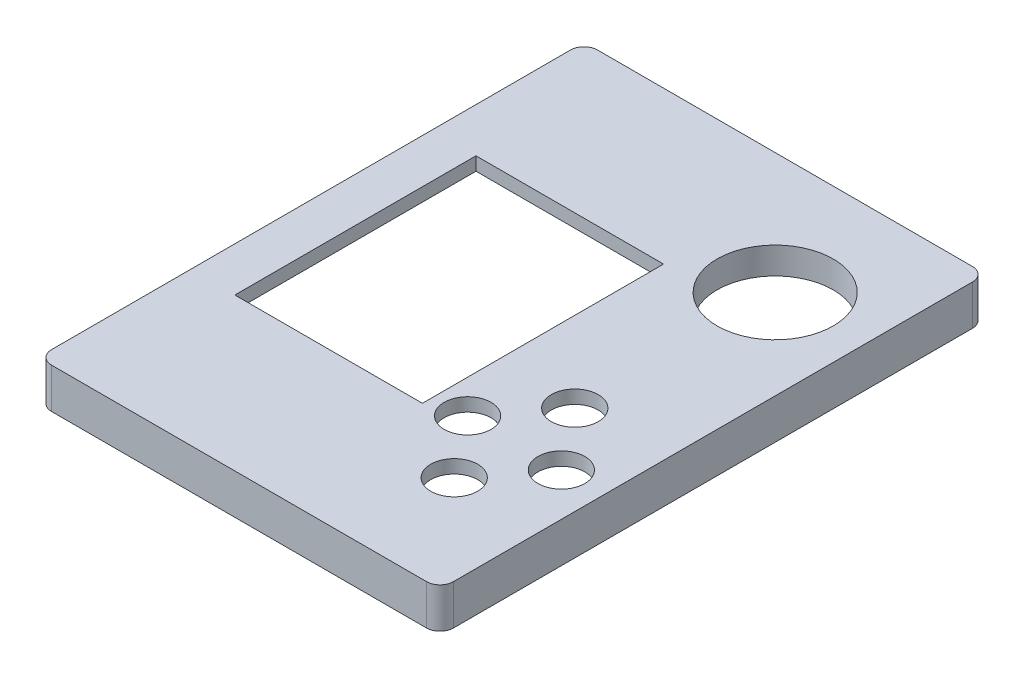
from build123d import *

# Parameters (mm, degrees)
BOSS_EXTRUDE1_DEPTH = 9
SKETCH2_R           = 1.45
CUT_EXTRUDE1_DEPTH  = 77.43471479
CUT_EXTRUDE2_REACH  = 78.435
SKETCH4_R           = 13
SHELL10_OUTLINE_W   = 84
SHELL10_OUTLINE_H   = 116.25
SHELL10_OUTLINE_R   = 4.45
SHELL10_OUTLINE_R_2 = 16
SHELL10_DEPTH       = 6
SKETCH5_R           = 16
CUT_EXTRUDE3_DEPTH  = 3
CUT_EXTRUDE4_REACH  = 78.14
SKETCH6_R           = 5.25
SKETCH6_W           = 42
SKETCH6_H           = 54
BOSS_EXTRUDE2_START = -2
SKETCH7_R           = 1.45
BOSS_EXTRUDE2_DEPTH = 2


# Read off the part's stored shape, not the designer's step: Shell10
with BuildPart() as part:
    # Sketch1 → Boss-Extrude1 (new body)
    with BuildSketch(Plane(origin=(0, 0, 0), x_dir=(1, 0, 0), z_dir=(0, 1, 0))):
        with BuildLine():
            Line((-42, -61.125), (42, -61.125))
            ThreePointArc((42, -61.125), (44.121320344, -60.246320344), (45, -58.125))
            Line((45, -58.125), (45, 58.125))
            ThreePointArc((45, 58.125), (44.121320344, 60.246320344), (42, 61.125))
            Line((42, 61.125), (-42, 61.125))
            ThreePointArc((-42, 61.125), (-44.121320344, 60.246320344), (-45, 58.125))
            Line((-45, 58.125), (-45, -58.125))
            ThreePointArc((-45, -58.125), (-44.121320344, -60.246320344), (-42, -61.125))
        make_face()
    extrude(amount=BOSS_EXTRUDE1_DEPTH)

    # Sketch2 → Cut-Extrude1 (cut, through all)
    with BuildSketch(Plane.XZ):
        with Locations(Location((-35.959, -52.125, 0), (0, 0, 270))):
            Circle(SKETCH2_R)
        with Locations(Location((-35.959, 37.875, 0), (0, 0, 270))):
            Circle(SKETCH2_R)
    cut_extrude1 = extrude(amount=-CUT_EXTRUDE1_DEPTH, mode=Mode.SUBTRACT)

    # Sketch4 → Cut-Extrude2 (cut, up to next)
    with BuildSketch(Plane(origin=(0, 9, 0), x_dir=(1, 0, 0), z_dir=(0, 1, 0)), mode=Mode.PRIVATE) as cut_extrude2_sk1:
        with Locations(Location((24.934417701, 34, 0), (0, 0, 270))):
            Circle(SKETCH4_R)
    cut_extrude2_tool1 = extrude(cut_extrude2_sk1.sketch, amount=-CUT_EXTRUDE2_REACH, mode=Mode.PRIVATE) & part.part
    add(cut_extrude2_tool1.solids().sort_by_distance((24.934418, 9, -34))[0], mode=Mode.SUBTRACT)

    # Mirror3: Cut-Extrude1 across plane
    add(cut_extrude1.mirror(Plane(origin=(0, 0, 0), x_dir=(0, 0, 1), z_dir=(1, 0, 0))), mode=Mode.SUBTRACT)

    # Shell10 outline → Shell10 (cut)
    with BuildSketch(Plane(origin=(0, 0, 0), x_dir=(1, 0, 0), z_dir=(0, 1, 0))):
        Rectangle(SHELL10_OUTLINE_W, SHELL10_OUTLINE_H)
        with Locations((-35.959, -37.875)):
            Circle(SHELL10_OUTLINE_R, mode=Mode.SUBTRACT)
        with Locations((35.959, -37.875)):
            Circle(SHELL10_OUTLINE_R, mode=Mode.SUBTRACT)
        with Locations((-35.959, 52.125)):
            Circle(SHELL10_OUTLINE_R, mode=Mode.SUBTRACT)
        with Locations((24.934417701, 34)):
            Circle(SHELL10_OUTLINE_R_2, mode=Mode.SUBTRACT)
        with Locations((35.959, 52.125)):
            Circle(SHELL10_OUTLINE_R, mode=Mode.SUBTRACT)
    extrude(amount=SHELL10_DEPTH, mode=Mode.SUBTRACT)

    # Sketch5 → Cut-Extrude3 (cut)
    with BuildSketch(Plane.XZ):
        with Locations(Location((24.934417701, -34, 0), (0, 0, 90))):
            Circle(SKETCH5_R)
    extrude(amount=-CUT_EXTRUDE3_DEPTH, mode=Mode.SUBTRACT)

    # Sketch6 → Cut-Extrude4 (cut, up to next)
    with BuildSketch(Plane.XZ.offset(-6), mode=Mode.PRIVATE) as cut_extrude4_sk1:
        with Locations(Location((35.434417701, 24.375, 0), (0, 0, 270))):
            Circle(SKETCH6_R)
    cut_extrude4_tool1 = extrude(cut_extrude4_sk1.sketch, amount=-CUT_EXTRUDE4_REACH, mode=Mode.PRIVATE) & part.part
    # Sketch6 → Cut-Extrude4 (cut, up to next)
    with BuildSketch(Plane.XZ.offset(-6), mode=Mode.PRIVATE) as cut_extrude4_sk2:
        with Locations(Location((14.434417701, 24.375, 0), (0, 0, 270))):
            Circle(SKETCH6_R)
    cut_extrude4_tool2 = extrude(cut_extrude4_sk2.sketch, amount=-CUT_EXTRUDE4_REACH, mode=Mode.PRIVATE) & part.part
    # Sketch6 → Cut-Extrude4 (cut, up to next)
    with BuildSketch(Plane.XZ.offset(-6), mode=Mode.PRIVATE) as cut_extrude4_sk3:
        with Locations(Location((24.934417701, 10.875, 0), (0, 0, 270))):
            Circle(SKETCH6_R)
    cut_extrude4_tool3 = extrude(cut_extrude4_sk3.sketch, amount=-CUT_EXTRUDE4_REACH, mode=Mode.PRIVATE) & part.part
    # Sketch6 → Cut-Extrude4 (cut, up to next)
    with BuildSketch(Plane.XZ.offset(-6), mode=Mode.PRIVATE) as cut_extrude4_sk4:
        with Locations(Location((24.934417701, 37.875, 0), (0, 0, 270))):
            Circle(SKETCH6_R)
    cut_extrude4_tool4 = extrude(cut_extrude4_sk4.sketch, amount=-CUT_EXTRUDE4_REACH, mode=Mode.PRIVATE) & part.part
    # Sketch6 → Cut-Extrude4 (cut, up to next)
    with BuildSketch(Plane.XZ.offset(-6), mode=Mode.PRIVATE) as cut_extrude4_sk5:
        with Locations((-14.065582299, 0)):
            Rectangle(SKETCH6_W, SKETCH6_H)
    cut_extrude4_tool5 = extrude(cut_extrude4_sk5.sketch, amount=-CUT_EXTRUDE4_REACH, mode=Mode.PRIVATE) & part.part
    add(cut_extrude4_tool1.solids().sort_by_distance((35.434418, 6, 24.375))[0], mode=Mode.SUBTRACT)
    add(cut_extrude4_tool2.solids().sort_by_distance((14.434418, 6, 24.375))[0], mode=Mode.SUBTRACT)
    add(cut_extrude4_tool3.solids().sort_by_distance((24.934418, 6, 10.875))[0], mode=Mode.SUBTRACT)
    add(cut_extrude4_tool4.solids().sort_by_distance((24.934418, 6, 37.875))[0], mode=Mode.SUBTRACT)
    add(cut_extrude4_tool5.solids().sort_by_distance((-14.065582, 6, 0))[0], mode=Mode.SUBTRACT)

    # Sketch7 → Boss-Extrude2 (add)
    with BuildSketch(Plane(origin=(0, 9, 0), x_dir=(1, 0, 0), z_dir=(0, 1, 0)).offset(BOSS_EXTRUDE2_START)):
        with Locations(Location((-35.959, -37.875, 0), (0, 0, 90))):
            Circle(SKETCH7_R)
        with Locations(Location((-35.959, 52.125, 0), (0, 0, 90))):
            Circle(SKETCH7_R)
        with Locations(Location((35.959, 52.125, 0), (0, 0, 90))):
            Circle(SKETCH7_R)
        with Locations(Location((35.959, -37.875, 0), (0, 0, 90))):
            Circle(SKETCH7_R)
    extrude(amount=BOSS_EXTRUDE2_DEPTH)


solid = part.part
